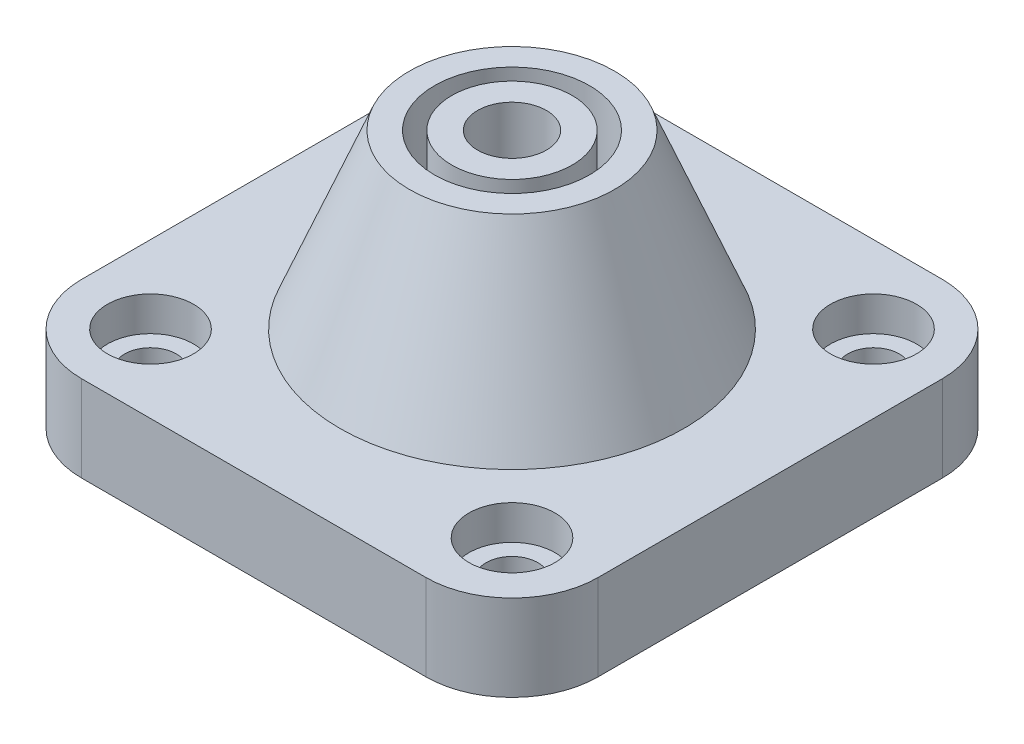
from build123d import *

# Parameters (mm, degrees)
SKETCH1_W               = 30
SKETCH1_H               = 30
BOSS_EXTRUDE1_DEPTH     = 5
SKETCH4_R               = 10
BOSS_EXTRUDE2_DEPTH     = 10
CUT_EXTRUDE3_DEPTH      = 26.980762114
CUT_EXTRUDE3_DEPTH_BACK = 26.980762114
SKETCH5_R               = 2
SKETCH6_R               = 4.5
SKETCH6_R_2             = 3.5
CUT_EXTRUDE4_DEPTH      = 7
CHAMFER1_SIZE           = 10
CHAMFER1_SIZE_2         = 4.040262258
CUT_EXTRUDE5_DEPTH      = 24.452078799
CUT_EXTRUDE5_DEPTH_BACK = 24.452078799
SKETCH8_R               = 1.5
SKETCH9_R               = 2.5
CUT_EXTRUDE6_DEPTH      = 2
FILLET1_R               = 5
CHAMFER2_SIZE           = 7
CHAMFER2_SIZE2          = 4.901452767


with BuildPart() as part:
    # Sketch1 → Boss-Extrude1 (new body)
    with BuildSketch(Plane(origin=(0, 0, 0), x_dir=(1, 0, 0), z_dir=(0, 1, 0))):
        Rectangle(SKETCH1_W, SKETCH1_H)
    extrude(amount=BOSS_EXTRUDE1_DEPTH)

    # Sketch4 → Boss-Extrude2 (add)
    with BuildSketch(Plane(origin=(0, 5, 0), x_dir=(1, 0, 0), z_dir=(0, 1, 0))):
        with Locations(Location((0, 0, 0), (0, 0, 270))):
            Circle(SKETCH4_R)
    extrude(amount=BOSS_EXTRUDE2_DEPTH)

    # Sketch5 → Cut-Extrude3 (cut, two sides: drawn at the far end of the back side and taken through both)
    with BuildSketch(Plane(origin=(0, 15, 0), x_dir=(1, 0, 0), z_dir=(0, 1, 0)).offset(-CUT_EXTRUDE3_DEPTH_BACK)):
        with Locations(Location((0, 0, 0), (0, 0, 270))):
            Circle(SKETCH5_R)
    extrude(amount=CUT_EXTRUDE3_DEPTH + CUT_EXTRUDE3_DEPTH_BACK, mode=Mode.SUBTRACT)

    # Sketch6 → Cut-Extrude4 (cut)
    with BuildSketch(Plane(origin=(0, 15, 0), x_dir=(1, 0, 0), z_dir=(0, 1, 0))):
        with Locations(Location((0, 0, 0), (0, 0, 270))):
            Circle(SKETCH6_R)
        with Locations(Location((0, 0, 0), (0, 0, 270))):
            Circle(SKETCH6_R_2, mode=Mode.SUBTRACT)
    extrude(amount=-CUT_EXTRUDE4_DEPTH, mode=Mode.SUBTRACT)

    # Chamfer1
    # the kernel refuses this chamfer: 10, 4.040262258 mm, written as the material it takes off along each edge
    with BuildSketch(Plane(origin=(0, 15, 0), x_dir=(0, 0, 1), z_dir=(-1, 0, 0))) as chamfer1_piece_1_section:
        Polygon((10, -CHAMFER1_SIZE), (10 - CHAMFER1_SIZE_2, 0), (10, 0), align=None)
    chamfer1_piece_1 = revolve(axis=Axis((0, 15, 0), (0, 1, 0)), mode=Mode.PRIVATE)
    chamfer1_piece_1 = split(chamfer1_piece_1, bisect_by=Plane(origin=(0, 5, -8.005876014), z_dir=(0, 1, 0)), keep=Keep.TOP, mode=Mode.PRIVATE)
    add(chamfer1_piece_1, mode=Mode.SUBTRACT)

    # Sketch8 → Cut-Extrude5 (cut, two sides: drawn at the far end of the back side and taken through both)
    with BuildSketch(Plane(origin=(0, 5, 0), x_dir=(1, 0, 0), z_dir=(0, 1, 0)).offset(-CUT_EXTRUDE5_DEPTH_BACK)):
        with Locations(Location((10.5, 10.5, 0), (0, 0, 270))):
            Circle(SKETCH8_R)
        with Locations(Location((10.5, -10.5, 0), (0, 0, 270))):
            Circle(SKETCH8_R)
        with Locations(Location((-10.5, -10.5, 0), (0, 0, 270))):
            Circle(SKETCH8_R)
        with Locations(Location((-10.5, 10.5, 0), (0, 0, 270))):
            Circle(SKETCH8_R)
    extrude(amount=CUT_EXTRUDE5_DEPTH + CUT_EXTRUDE5_DEPTH_BACK, mode=Mode.SUBTRACT)

    # Sketch9 → Cut-Extrude6 (cut)
    with BuildSketch(Plane(origin=(0, 5, 0), x_dir=(1, 0, 0), z_dir=(0, 1, 0))):
        with Locations(Location((-10.5, 10.5, 0), (0, 0, 270))):
            Circle(SKETCH9_R)
        with Locations(Location((10.5, 10.5, 0), (0, 0, 270))):
            Circle(SKETCH9_R)
        with Locations(Location((10.5, -10.5, 0), (0, 0, 270))):
            Circle(SKETCH9_R)
        with Locations(Location((-10.5, -10.5, 0), (0, 0, 270))):
            Circle(SKETCH9_R)
    extrude(amount=-CUT_EXTRUDE6_DEPTH, mode=Mode.SUBTRACT)

    # Fillet1
    fillet1_edges = [part.edges().sort_by_distance(p)[0] for p in [
        (15, 2.5, 15),
        (-15, 2.5, 15),
        (-15, 2.5, -15),
        (15, 2.5, -15),
    ]]
    fillet(fillet1_edges, radius=FILLET1_R)

    # Chamfer2
    chamfer2_edges = [part.edges().sort_by_distance(p)[0] for p in [
        (0, 0, -2),
    ]]
    chamfer2_side = [part.faces().sort_by_distance(p)[0] for p in [
        (0, 7.5, -2),
    ]]
    chamfer(chamfer2_edges, length=CHAMFER2_SIZE, length2=CHAMFER2_SIZE2, reference=chamfer2_side[0])


solid = part.part
